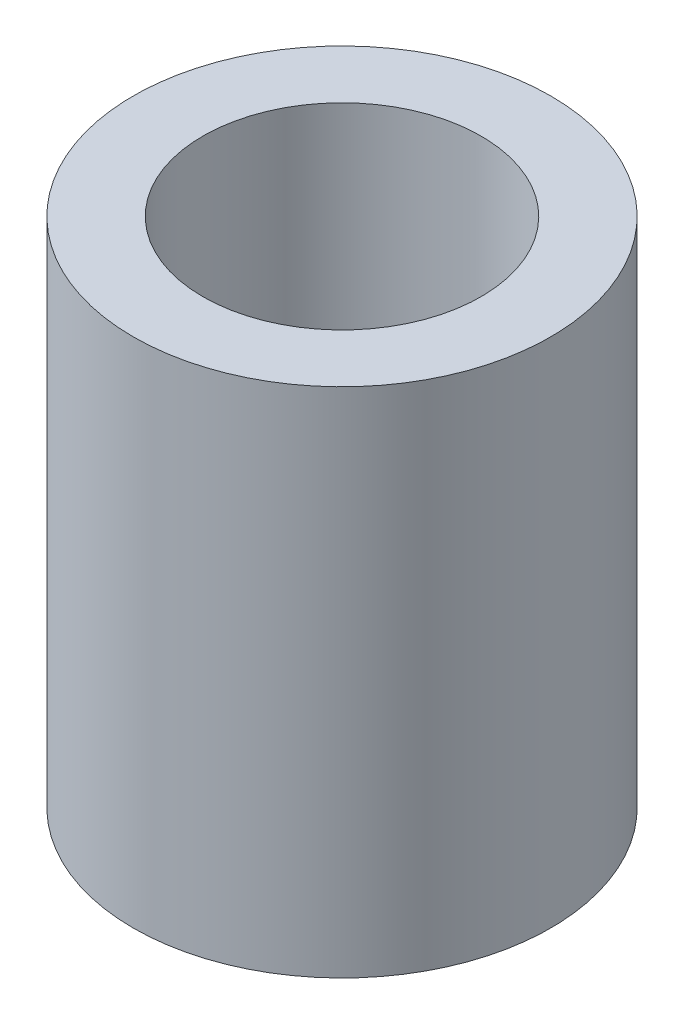
from build123d import *

# Parameters (mm, degrees)
SKETCH1_R           = 4.7625
SKETCH1_R_2         = 3.175
BOSS_EXTRUDE1_DEPTH = 11.684


with BuildPart() as part:
    # Sketch1 → Boss-Extrude1 (new body)
    with BuildSketch(Plane(origin=(0, 0, 0), x_dir=(1, 0, 0), z_dir=(0, 1, 0))):
        Circle(SKETCH1_R)
        Circle(SKETCH1_R_2, mode=Mode.SUBTRACT)
    extrude(amount=BOSS_EXTRUDE1_DEPTH)


solid = part.part
